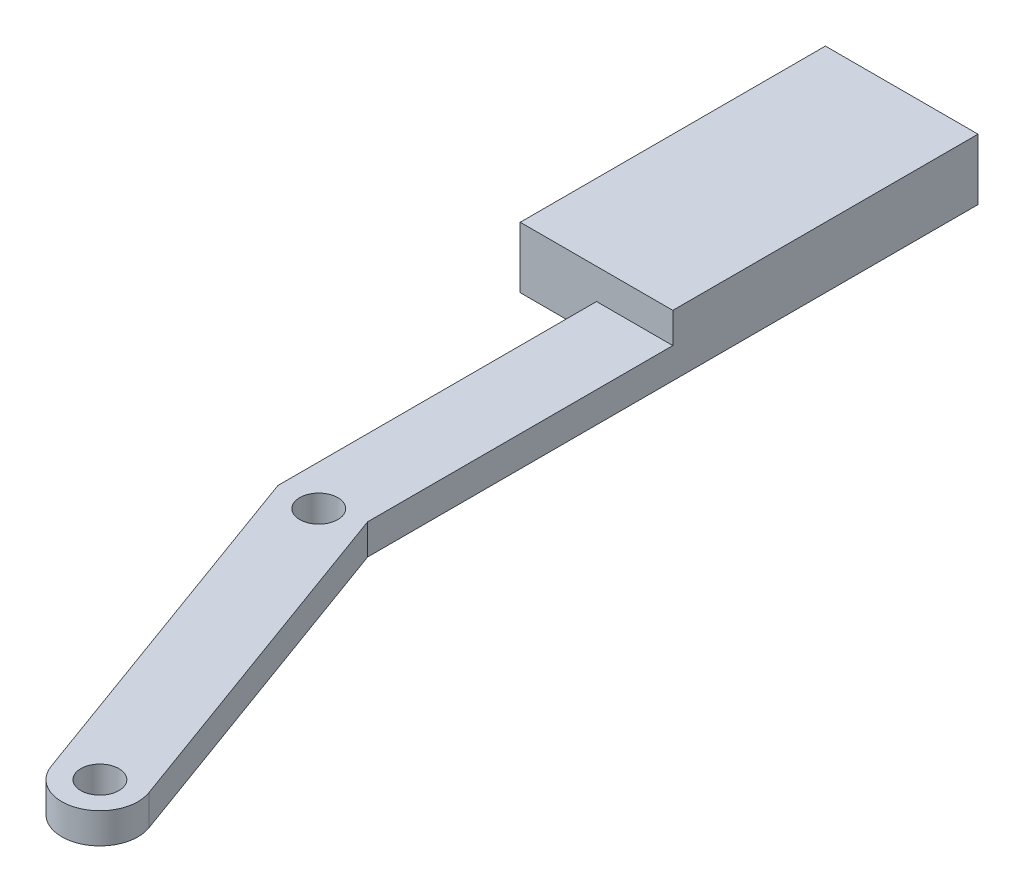
from build123d import *

# Parameters (mm, degrees)
SKETCH1_R           = 1.5875
BOSS_EXTRUDE1_DEPTH = 5.08
RIGHT_CUT_DEPTH     = 2.54


with BuildPart() as part:
    # Sketch1 → Boss-Extrude1 (new body)
    with BuildSketch(Plane(origin=(0, 0, 0), x_dir=(1, 0, 0), z_dir=(0, 1, 0))):
        with BuildLine():
            Line((-6.35, -13.819676327), (-6.35, 12.7))
            Line((-6.35, 12.7), (-12.7, 12.7))
            Line((-12.7, 12.7), (-12.7, 38.1))
            Line((-12.7, 38.1), (0, 38.1))
            Line((0, 38.1), (0, -12.7))
            Line((0, -12.7), (10.424773969, -41.341831082))
            ThreePointArc((10.424773969, -41.341831082), (8.527163853, -45.411269108), (4.457725827, -43.513658992))
            Line((4.457725827, -43.513658992), (-6.35, -13.819676327))
        make_face()
        with Locations((7.441249898, -42.427745037)):
            Circle(SKETCH1_R, mode=Mode.SUBTRACT)
        with Locations((-2.983524071, -13.785913955)):
            Circle(SKETCH1_R, mode=Mode.SUBTRACT)
    extrude(amount=BOSS_EXTRUDE1_DEPTH)

    # Sketch2 → Right Cut (cut)
    with BuildSketch(Plane(origin=(0, 5.08, 0), x_dir=(1, 0, 0), z_dir=(0, 1, 0))):
        Polygon((-6.35, -13.819676327), (5.543639782, -46.497183063), (11.510687924, -44.325355153), (0, -12.7), (0, 12.7), (-6.35, 12.7), align=None)
    extrude(amount=-RIGHT_CUT_DEPTH, mode=Mode.SUBTRACT)


solid = part.part
